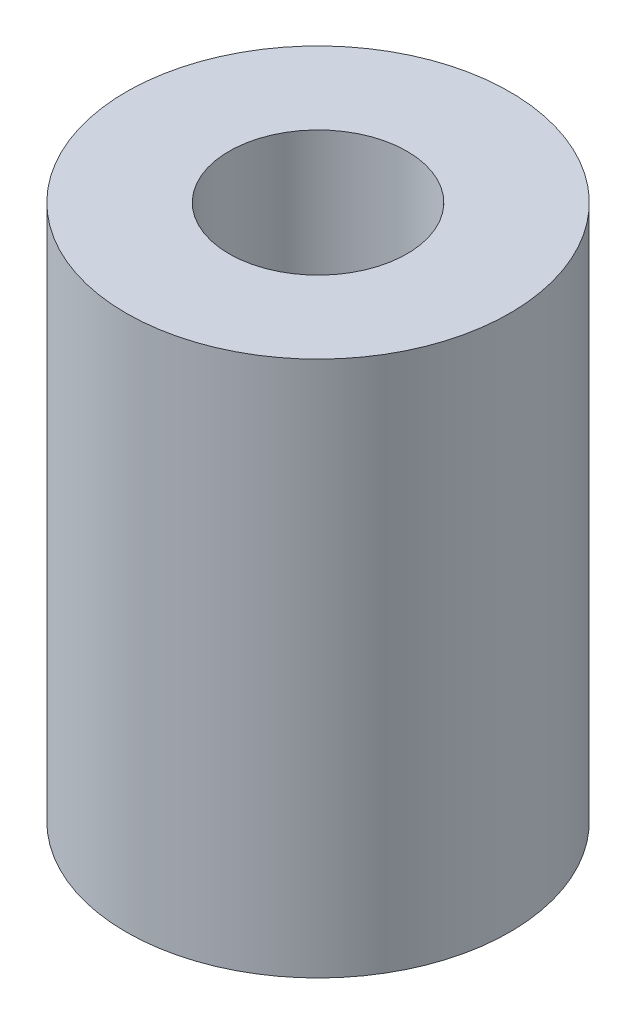
from build123d import *

# Parameters (mm, degrees)
SKETCH1_R           = 3.45
SKETCH1_R_2         = 1.6
BOSS_EXTRUDE1_DEPTH = 9.64


with BuildPart() as part:
    # Sketch1 → Boss-Extrude1 (new body)
    with BuildSketch(Plane(origin=(0, 0, 0), x_dir=(1, 0, 0), z_dir=(0, 1, 0))):
        Circle(SKETCH1_R)
        Circle(SKETCH1_R_2, mode=Mode.SUBTRACT)
    extrude(amount=BOSS_EXTRUDE1_DEPTH)


solid = part.part
